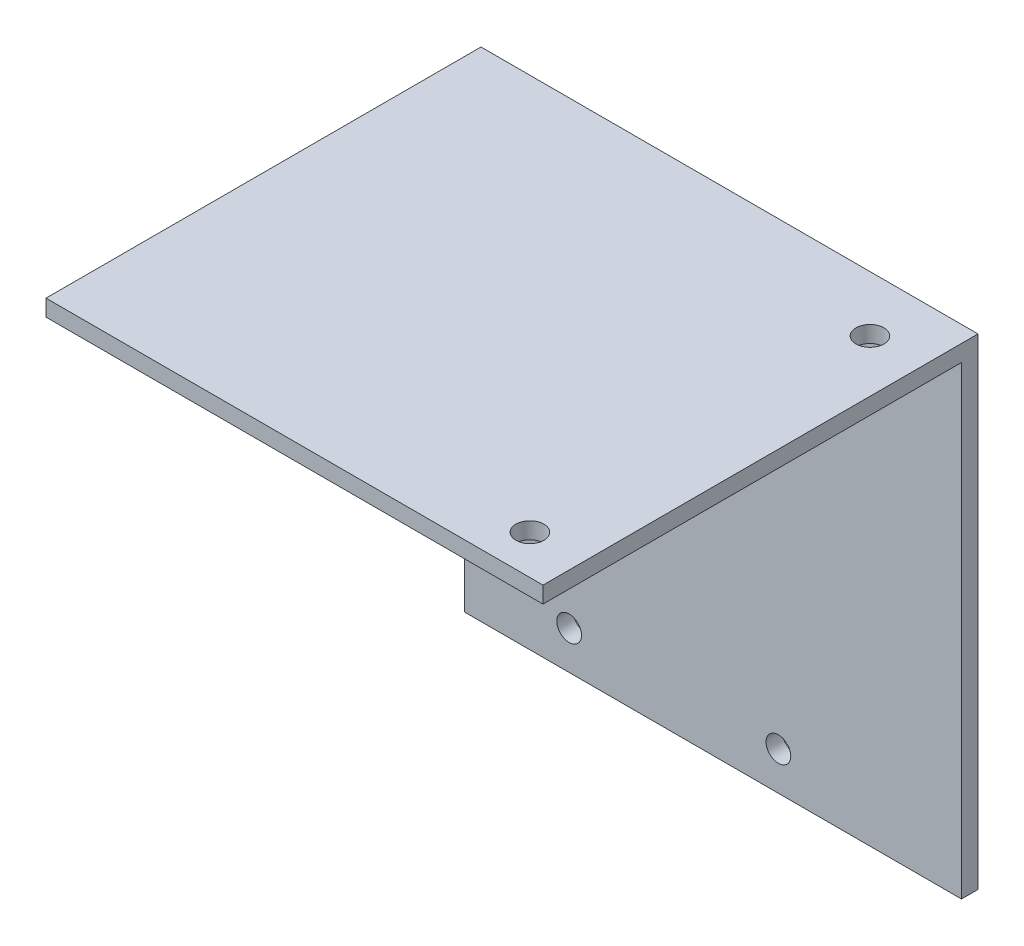
from build123d import *

# Parameters (mm, degrees)
SKETCH1_W           = 60.325
SKETCH1_H           = 58.4
SKETCH1_R           = 1.5
BOSS_EXTRUDE1_DEPTH = 2
SKETCH2_W           = 60.325
SKETCH2_H           = 2
BOSS_EXTRUDE2_DEPTH = 52.8
SKETCH3_R           = 1.7
CUT_EXTRUDE1_DEPTH  = 99.134120595


with BuildPart() as part:
    # Sketch1 → Boss-Extrude1 (new body)
    with BuildSketch(Plane.XY):
        with Locations((30.1625, 29.2)):
            Rectangle(SKETCH1_W, SKETCH1_H)
        with Locations((12.7, 51.75)):
            Circle(SKETCH1_R, mode=Mode.SUBTRACT)
        with Locations((38.1, 51.75)):
            Circle(SKETCH1_R, mode=Mode.SUBTRACT)
        with Locations((12.7, 4.65)):
            Circle(SKETCH1_R, mode=Mode.SUBTRACT)
        with Locations((38.1, 4.65)):
            Circle(SKETCH1_R, mode=Mode.SUBTRACT)
    extrude(amount=-BOSS_EXTRUDE1_DEPTH)

    # Sketch2 → Boss-Extrude2 (add)
    with BuildSketch(Plane(origin=(0, 0, -2), x_dir=(-1, 0, 0), z_dir=(0, 0, -1))):
        with Locations((-30.1625, 57.4)):
            Rectangle(SKETCH2_W, SKETCH2_H)
    extrude(amount=-BOSS_EXTRUDE2_DEPTH)

    # Sketch3 → Cut-Extrude1 (cut, through all)
    with BuildSketch(Plane(origin=(0, 58.4, 0), x_dir=(1, 0, 0), z_dir=(0, 1, 0))):
        with Locations((53.975, -4.7625)):
            Circle(SKETCH3_R)
        with Locations((53.975, -46.0375)):
            Circle(SKETCH3_R)
    extrude(amount=-CUT_EXTRUDE1_DEPTH, mode=Mode.SUBTRACT)


solid = part.part
